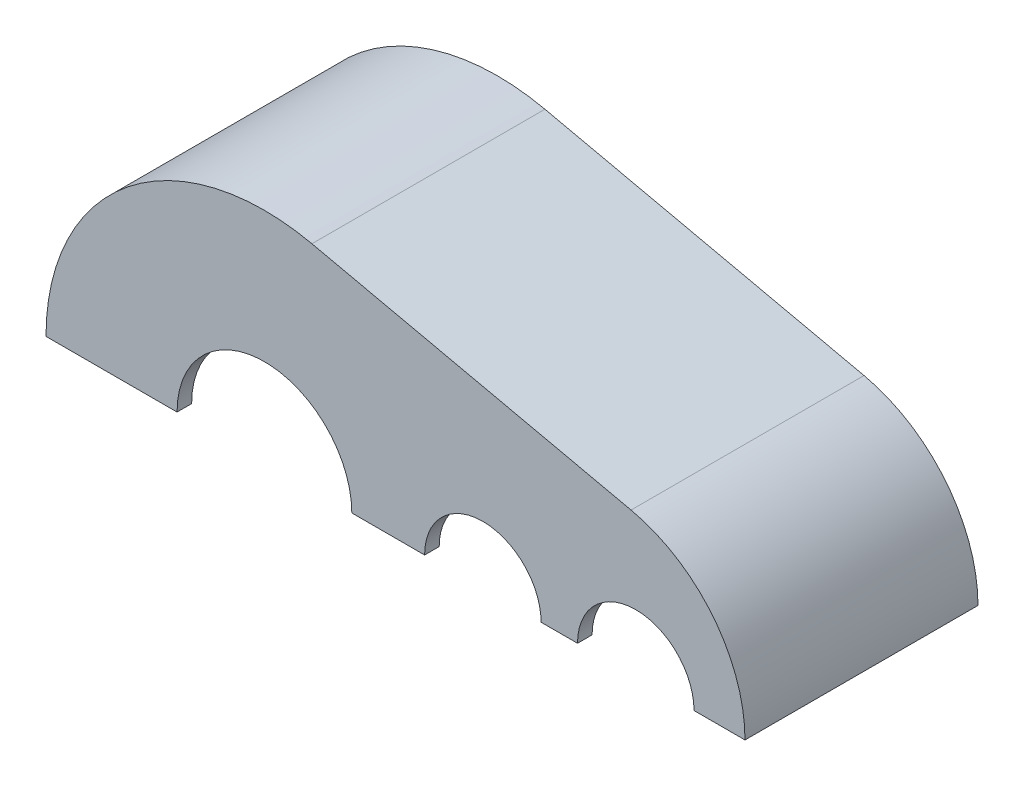
from build123d import *

# Parameters (mm, degrees)
SKETCH1_W               = 480
SKETCH1_H               = 160
BOSS_EXTRUDE1_DEPTH     = 150
CUT_EXTRUDE3_DEPTH      = 295.108823397
CUT_EXTRUDE3_DEPTH_BACK = 295.108823397
SKETCH3_OUTSIDE_W       = 587.546
SKETCH3_OUTSIDE_H       = 257.546
CUT_EXTRUDE4_DEPTH      = 295.108823397
CUT_EXTRUDE4_DEPTH_BACK = 295.108823397
SKETCH5_R               = 60
SKETCH5_R_2             = 40
SHELL1_T                = -10


with BuildPart() as part:
    # Sketch1 → Boss-Extrude1 (new body)
    with BuildSketch(Plane(origin=(0, 0, 0), x_dir=(1, 0, 0), z_dir=(0, 1, 0))):
        Rectangle(SKETCH1_W, SKETCH1_H)
    extrude(amount=BOSS_EXTRUDE1_DEPTH)

    # Sketch3 outside → Cut-Extrude3 (cut, two sides: drawn at the far end of the back side and taken through both)
    with BuildSketch(Plane.XY.offset(-CUT_EXTRUDE3_DEPTH_BACK)):
        with Locations((0, 75)):
            Rectangle(SKETCH3_OUTSIDE_W, SKETCH3_OUTSIDE_H)
        with BuildLine():
            Line((-57.391304348, 146.412680352), (161.739130435, 97.608453568))
            ThreePointArc((161.739130435, 97.608453568), (218.018949761, 62.554324217), (240, 0))
            Line((240, 0), (-240, 0))
            ThreePointArc((-240, 0), (-183.831486326, 117.028424641), (-57.391304348, 146.412680352))
        make_face(mode=Mode.SUBTRACT)
    extrude(amount=CUT_EXTRUDE3_DEPTH + CUT_EXTRUDE3_DEPTH_BACK, mode=Mode.SUBTRACT)

    # Sketch5 → Cut-Extrude4 (cut, two sides: drawn at the far end of the back side and taken through both)
    with BuildSketch(Plane.XY.offset(-CUT_EXTRUDE4_DEPTH_BACK)):
        with Locations((-90, 0)):
            Circle(SKETCH5_R)
        with Locations((60, 0)):
            Circle(SKETCH5_R_2)
        with Locations((165, 0)):
            Circle(SKETCH5_R_2)
    extrude(amount=CUT_EXTRUDE4_DEPTH + CUT_EXTRUDE4_DEPTH_BACK, mode=Mode.SUBTRACT)

    # Shell1
    shell1_openings = [part.faces().sort_by_distance(p)[0] for p in [
        (165, 40, 0),
        (60, 40, 0),
        (-90, 60, 0),
        (222.5, 0, 0),
        (112.5, 0, 0),
        (-5, 0, 0),
        (-195, 0, 0),
    ]]
    offset(amount=SHELL1_T, openings=shell1_openings, kind=Kind.INTERSECTION)


solid = part.part
